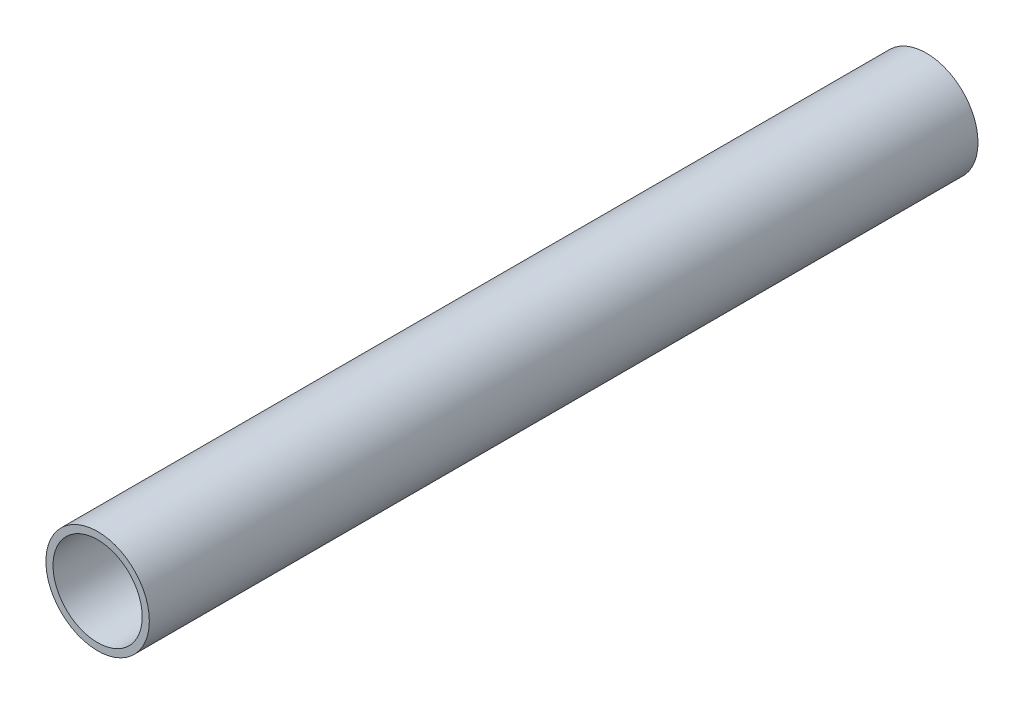
from build123d import *

# Parameters (mm, degrees)
SKETCH1_R           = 8
SKETCH1_R_2         = 6.9
BOSS_EXTRUDE1_DEPTH = 128.2


with BuildPart() as part:
    # Sketch1 → Boss-Extrude1 (new body)
    with BuildSketch(Plane.XY):
        Circle(SKETCH1_R)
        Circle(SKETCH1_R_2, mode=Mode.SUBTRACT)
    extrude(amount=BOSS_EXTRUDE1_DEPTH)


solid = part.part
